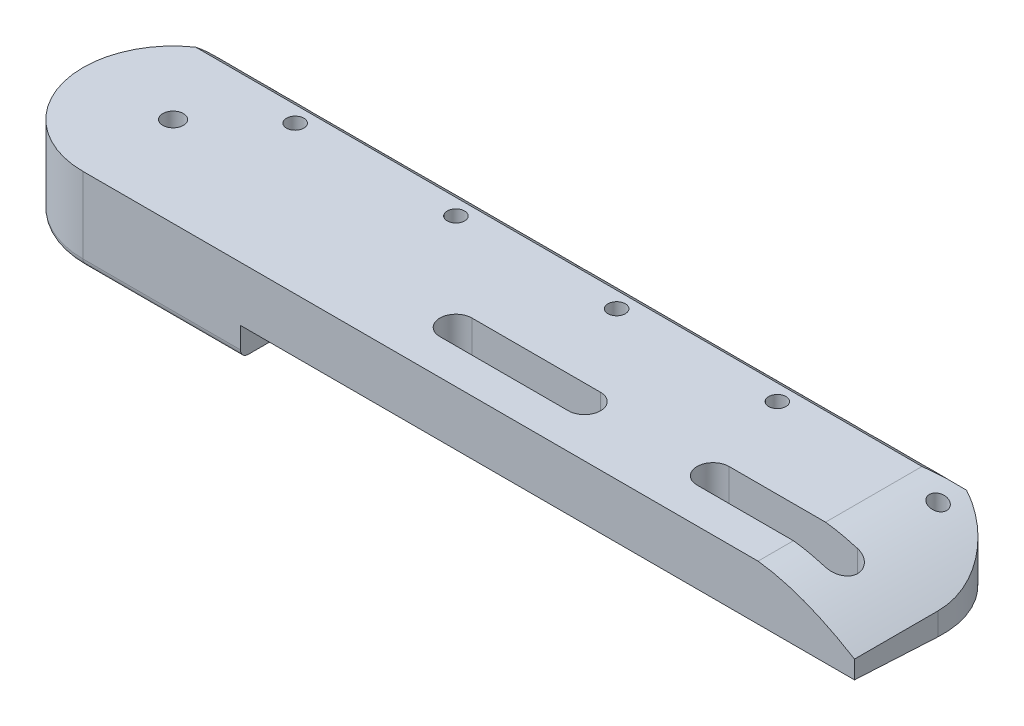
from build123d import *

# Parameters (mm, degrees)
SKETCH1_R           = 1.35
SKETCH1_R_2         = 3
BOSS_EXTRUDE1_DEPTH = 10
SKETCH9_R           = 3
BOSS_EXTRUDE2_DEPTH = 3
SKETCH10_W          = 38
SKETCH10_H          = 6
CUT_EXTRUDE3_DEPTH  = 8
FILLET3_R           = 15
FILLET4_R           = 1.2
CUT_EXTRUDE4_REACH  = 137.355
CUT_EXTRUDE5_DEPTH  = 56
SKETCH13_R          = 3
SKETCH13_R_2        = 1.6
BOSS_EXTRUDE3_DEPTH = 5
FILLET5_R           = 1.2
CUT_EXTRUDE6_DEPTH  = 160.5
SKETCH15_W          = 146.140561772
SKETCH15_H          = 38.947987949
CUT_EXTRUDE7_DEPTH  = 13


with BuildPart() as part:
    # Sketch1 → Boss-Extrude1 (new body)
    with BuildSketch(Plane(origin=(0, 0, 0), x_dir=(1, 0, 0), z_dir=(0, 1, 0))):
        with BuildLine():
            Line((0, 14), (120, 14))
            Line((120, 14), (120, -14))
            Line((120, -14), (0, -14))
            ThreePointArc((0, -14), (-14, 0), (0, 14))
        make_face()
        with Locations(Location((85, 9, 0), (0, 0, 270))):
            Circle(SKETCH1_R, mode=Mode.SUBTRACT)
        with Locations(Location((60, 9, 0), (0, 0, 270))):
            Circle(SKETCH1_R, mode=Mode.SUBTRACT)
        with Locations(Location((110, 9, 0), (0, 0, 270))):
            Circle(SKETCH1_R, mode=Mode.SUBTRACT)
        with Locations(Location((10, 9, 0), (0, 0, 90))):
            Circle(SKETCH1_R, mode=Mode.SUBTRACT)
        with Locations(Location((35, 9, 0), (0, 0, 90))):
            Circle(SKETCH1_R, mode=Mode.SUBTRACT)
        with Locations(Location((0, 0, 0), (0, 0, 270))):
            Circle(SKETCH1_R_2, mode=Mode.SUBTRACT)
        with BuildLine():
            Line((70, -8.5), (50, -8.5))
            ThreePointArc((50, -8.5), (47.5, -6), (50, -3.5))
            Line((50, -3.5), (70, -3.5))
            ThreePointArc((70, -3.5), (72.5, -6), (70, -8.5))
        make_face(mode=Mode.SUBTRACT)
        with BuildLine():
            Line((90, -3.5), (110, -3.5))
            ThreePointArc((110, -3.5), (112.5, -6), (110, -8.5))
            Line((110, -8.5), (90, -8.5))
            ThreePointArc((90, -8.5), (87.5, -6), (90, -3.5))
        make_face(mode=Mode.SUBTRACT)
    extrude(amount=BOSS_EXTRUDE1_DEPTH)

    # Sketch9 → Boss-Extrude2 (add)
    with BuildSketch(Plane(origin=(0, 10, 0), x_dir=(1, 0, 0), z_dir=(0, 1, 0))):
        with BuildLine():
            Line((0, 14), (24.5, 14))
            Line((24.5, 14), (24.5, -14))
            Line((24.5, -14), (0, -14))
            ThreePointArc((0, -14), (-14, 0), (0, 14))
        make_face()
        with Locations(Location((0, 0, 0), (0, 0, 270))):
            Circle(SKETCH9_R, mode=Mode.SUBTRACT)
    extrude(amount=BOSS_EXTRUDE2_DEPTH)

    # Sketch10 → Cut-Extrude3 (cut)
    with BuildSketch(Plane(origin=(0, 13, 0), x_dir=(1, 0, 0), z_dir=(0, 1, 0))):
        with Locations((19, 0)):
            Rectangle(SKETCH10_W, SKETCH10_H)
    extrude(amount=-CUT_EXTRUDE3_DEPTH, mode=Mode.SUBTRACT)

    # Fillet3
    fillet3_edges = [part.edges().sort_by_distance(p)[0] for p in [
        (120, 5, -14),
    ]]
    fillet(fillet3_edges, radius=FILLET3_R)

    # Fillet4
    # the kernel refuses this fillet: 1.2 mm, written as the material it adds along each edge
    with BuildSketch(Plane(origin=(-3, 5, -3), x_dir=(0, 1, 0), z_dir=(1, 0, 0))) as fillet4_piece_1_section:
        with BuildLine():
            CenterArc((FILLET4_R, FILLET4_R), FILLET4_R, 180, 90)
            Line((0, FILLET4_R), (0, 0))
            Line((0, 0), (FILLET4_R, 0))
        make_face()
    fillet4_piece_1 = extrude(amount=44, mode=Mode.PRIVATE)
    fillet4_piece_1 = fillet4_piece_1 - Plane(origin=(0, 5.276873311, 0), x_dir=(0, 0, 1), z_dir=(0, -1, 0)) * Cylinder(3, 93, mode=Mode.PRIVATE)
    add(fillet4_piece_1)
    with BuildSketch(Plane(origin=(41, 5, 3), x_dir=(0, 1, 0), z_dir=(-1, 0, 0))) as fillet4_piece_2_section:
        with BuildLine():
            CenterArc((FILLET4_R, FILLET4_R), FILLET4_R, 180, 90)
            Line((0, FILLET4_R), (0, 0))
            Line((0, 0), (FILLET4_R, 0))
        make_face()
    fillet4_piece_2 = extrude(amount=44, mode=Mode.PRIVATE)
    fillet4_piece_2 = fillet4_piece_2 - Plane(origin=(0, 5.276873499, 0), x_dir=(0, 0, 1), z_dir=(0, -1, 0)) * Cylinder(3, 93, mode=Mode.PRIVATE)
    add(fillet4_piece_2)

    # Cut-Extrude4: up to this face of the body (flat: up to its plane)
    cut_extrude4_end = Plane(part.part.faces().sort_by_distance((24.5, 11.5, 8.5))[0])
    # Sketch4 → Cut-Extrude4 (cut, up to the picked face)
    with BuildSketch(Plane(origin=(120, 0, 0), x_dir=(0, 0, -1), z_dir=(1, 0, 0)), mode=Mode.PRIVATE) as cut_extrude4_sk1:
        Polygon((-14, 10), (-14, 8.5), (14, 10), align=None)
    cut_extrude4_tool1 = split(extrude(cut_extrude4_sk1.sketch, amount=-CUT_EXTRUDE4_REACH, mode=Mode.PRIVATE), bisect_by=cut_extrude4_end, keep=Keep.BOTH, mode=Mode.PRIVATE)
    add(cut_extrude4_tool1.solids().sort_by(Axis((120, 9.5, 4.666667), (-1, 0, 0)))[0], mode=Mode.SUBTRACT)

    # Sketch11 → Cut-Extrude5 (cut)
    with BuildSketch(Plane(origin=(0, 0, -14), x_dir=(-1, 0, 0), z_dir=(0, 0, -1))):
        with BuildLine():
            add(Edge.make_bspline(
                [(-120, 5.696428571), (-112.075751897, 0.845176506), (-105, 0)],
                knots=[0, 0, 0, 0.27358728, 0.27358728, 0.27358728], degree=2))
            Line((-105, 0), (-120, 0))
            Line((-120, 0), (-120, 5.696428571))
        make_face()
    extrude(amount=-CUT_EXTRUDE5_DEPTH, mode=Mode.SUBTRACT)

    # Sketch13 → Boss-Extrude3 (add)
    with BuildSketch(Plane.XZ):
        Circle(SKETCH13_R)
        with Locations(Location((0, 0, 0), (0, 0, 270))):
            Circle(SKETCH13_R_2, mode=Mode.SUBTRACT)
    extrude(amount=-BOSS_EXTRUDE3_DEPTH)

    # Fillet5
    fillet5_edges = [part.edges().sort_by_distance(p)[0] for p in [
        (-14, 13, 0),
        (12.25, 13, 14),
        (12.25, 13, -14),
    ]]
    fillet(fillet5_edges, radius=FILLET5_R)

    # Sketch14 → Cut-Extrude6 (cut)
    with BuildSketch(Plane(origin=(120, 0, 0), x_dir=(0, 0, -1), z_dir=(1, 0, 0))):
        with BuildLine():
            Line((14, 0), (11.5, 0))
            add(Edge.make_bspline(
                [(11.5, 0), (13.101323316, 0.782640841), (14, 3)],
                knots=[0, 0, 0, 0.269080741, 0.269080741, 0.269080741], degree=2))
            Line((14, 3), (14, 0))
        make_face()
    extrude(amount=-CUT_EXTRUDE6_DEPTH, mode=Mode.SUBTRACT)

    # Mirror1: part across plane


with BuildPart() as part_1:
    add(part.part)
    add(part.part.mirror(Plane.ZX.offset(13)))

    # Sketch15 → Cut-Extrude7 (cut)
    with BuildSketch(Plane.XZ):
        with Locations((46.929719114, -5.473993975)):
            Rectangle(SKETCH15_W, SKETCH15_H)
    extrude(amount=-CUT_EXTRUDE7_DEPTH, mode=Mode.SUBTRACT)


solid = part_1.part
